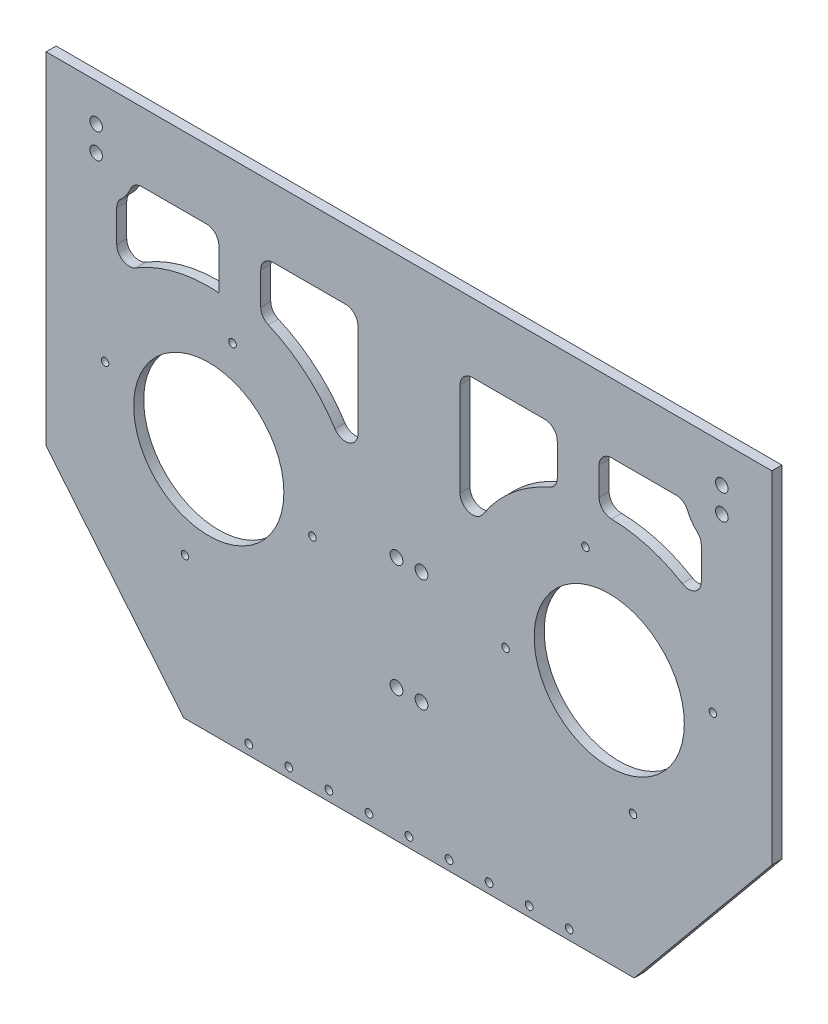
from build123d import *

# Parameters (mm, degrees)
SKETCH1_R           = 2.55
SKETCH1_R_2         = 2.5
BOSS_EXTRUDE1_DEPTH = 4
SKETCH2_R           = 1.5
SKETCH2_R_2         = 30
CUT_EXTRUDE1_DEPTH  = 10
SKETCH3_R           = 1.55
CUT_EXTRUDE2_DEPTH  = 189.257801963
CUT_EXTRUDE3_DEPTH  = 189.257801963
FILLET1_R           = 5


with BuildPart() as part:
    # Sketch1 → Boss-Extrude1 (new body)
    with BuildSketch(Plane.XY):
        Polygon((-145, 120), (-145, -16.387087703), (-90, -83), (90, -83), (145, -16.387087703), (145, 120), align=None)
        with Locations((-5, -30)):
            Circle(SKETCH1_R, mode=Mode.SUBTRACT)
        with Locations((-5, 15)):
            Circle(SKETCH1_R, mode=Mode.SUBTRACT)
        with Locations((5, -30)):
            Circle(SKETCH1_R, mode=Mode.SUBTRACT)
        with Locations((5, 15)):
            Circle(SKETCH1_R, mode=Mode.SUBTRACT)
        with Locations((-125, 95)):
            Circle(SKETCH1_R_2, mode=Mode.SUBTRACT)
        with Locations((-125, 105)):
            Circle(SKETCH1_R_2, mode=Mode.SUBTRACT)
        with Locations((125, 95)):
            Circle(SKETCH1_R_2, mode=Mode.SUBTRACT)
        with Locations((125, 105)):
            Circle(SKETCH1_R_2, mode=Mode.SUBTRACT)
    extrude(amount=BOSS_EXTRUDE1_DEPTH)

    # Sketch2 → Cut-Extrude1 (cut)
    with BuildSketch(Plane.XY.offset(4)):
        with Locations((38.573620895, 5.507628631)):
            Circle(SKETCH2_R)
        with Locations((70.507628631, 56.426379105)):
            Circle(SKETCH2_R)
        with Locations((121.426379105, 24.492371369)):
            Circle(SKETCH2_R)
        with Locations((89.492371369, -26.426379105)):
            Circle(SKETCH2_R)
        with Locations((80, 15)):
            Circle(SKETCH2_R_2)
        with Locations((-38.573620895, 5.507628631)):
            Circle(SKETCH2_R)
        with Locations((-70.507628631, 56.426379105)):
            Circle(SKETCH2_R)
        with Locations((-89.492371369, -26.426379105)):
            Circle(SKETCH2_R)
        with Locations((-121.426379105, 24.492371369)):
            Circle(SKETCH2_R)
        with Locations((-80, 15)):
            Circle(SKETCH2_R_2)
    extrude(amount=-CUT_EXTRUDE1_DEPTH, mode=Mode.SUBTRACT)

    # Sketch3 → Cut-Extrude2 (cut, through all)
    with BuildSketch(Plane.XY.offset(4)):
        with Locations((-64, -79)):
            Circle(SKETCH3_R)
        with Locations((-48, -79)):
            Circle(SKETCH3_R)
        with Locations((-32, -79)):
            Circle(SKETCH3_R)
        with Locations((-16, -79)):
            Circle(SKETCH3_R)
        with Locations((0, -79)):
            Circle(SKETCH3_R)
        with Locations((16, -79)):
            Circle(SKETCH3_R)
        with Locations((32, -79)):
            Circle(SKETCH3_R)
        with Locations((48, -79)):
            Circle(SKETCH3_R)
        with Locations((64, -79)):
            Circle(SKETCH3_R)
    extrude(amount=-CUT_EXTRUDE2_DEPTH, mode=Mode.SUBTRACT)

    # Sketch6 → Cut-Extrude3 (cut, through all)
    with BuildSketch(Plane(origin=(0, 0, 0), x_dir=(-1, 0, 0), z_dir=(0, 0, -1))):
        with BuildLine():
            ThreePointArc((-59.239754761, 71.135764515), (-32.477390126, 51.384246466), (-20.392124849, 20.395651962))
            Line((-20.392124849, 20.395651962), (-20.392124849, 92.456219591))
            Line((-20.392124849, 92.456219591), (-59.239754761, 92.456219591))
            Line((-59.239754761, 92.456219591), (-59.239754761, 71.135764515))
        make_face()
        with BuildLine():
            Line((-75.962334301, 71.135764515), (-75.962334301, 92.456219591))
            Line((-75.962334301, 92.456219591), (-110.419712469, 92.456219591))
            ThreePointArc((-110.419712469, 92.456219591), (-112.597288394, 86.923593121), (-116.776447851, 82.694359289))
            Line((-116.776447851, 82.694359289), (-116.776447851, 57.603047842))
            ThreePointArc((-116.776447851, 57.603047842), (-97.712723375, 68.420840808), (-75.962334301, 71.135764515))
        make_face()
        with BuildLine():
            Line((20.392124849, 92.456219591), (20.392124849, 20.395651962))
            ThreePointArc((20.392124849, 20.395651962), (32.477390126, 51.384246466), (59.239754761, 71.135764515))
            Line((59.239754761, 71.135764515), (59.239754761, 92.456219591))
            Line((59.239754761, 92.456219591), (20.392124849, 92.456219591))
        make_face()
        with BuildLine():
            Line((110.419712469, 92.456219591), (75.962334301, 92.456219591))
            Line((75.962334301, 92.456219591), (75.962334301, 71.135764515))
            ThreePointArc((75.962334301, 71.135764515), (97.712723375, 68.420840808), (116.776447851, 57.603047842))
            Line((116.776447851, 57.603047842), (116.776447851, 82.694359289))
            ThreePointArc((116.776447851, 82.694359289), (112.597288394, 86.923593121), (110.419712469, 92.456219591))
        make_face()
    extrude(amount=-CUT_EXTRUDE3_DEPTH, mode=Mode.SUBTRACT)

    # Fillet1
    fillet1_edges = [part.edges().sort_by_distance(p)[0] for p in [
        (-59.239754761, 92.456219591, 2),
        (-110.419712469, 92.456219591, 2),
        (-116.776447851, 82.694359289, 2),
        (-59.239754761, 71.135764515, 2),
        (-116.776447851, 57.603047842, 2),
        (-75.962334301, 92.456219591, 2),
        (-20.392124849, 92.456219591, 2),
        (-20.392124849, 20.395651962, 2),
        (20.392124849, 20.395651962, 2),
        (59.239754761, 92.456219591, 2),
        (59.239754761, 71.135764515, 2),
        (20.392124849, 92.456219591, 2),
        (75.962334301, 92.456219591, 2),
        (75.962334301, 71.135764515, 2),
        (110.419712469, 92.456219591, 2),
        (116.776447851, 82.694359289, 2),
        (116.776447851, 57.603047842, 2),
    ]]
    fillet(fillet1_edges, radius=FILLET1_R)


solid = part.part
